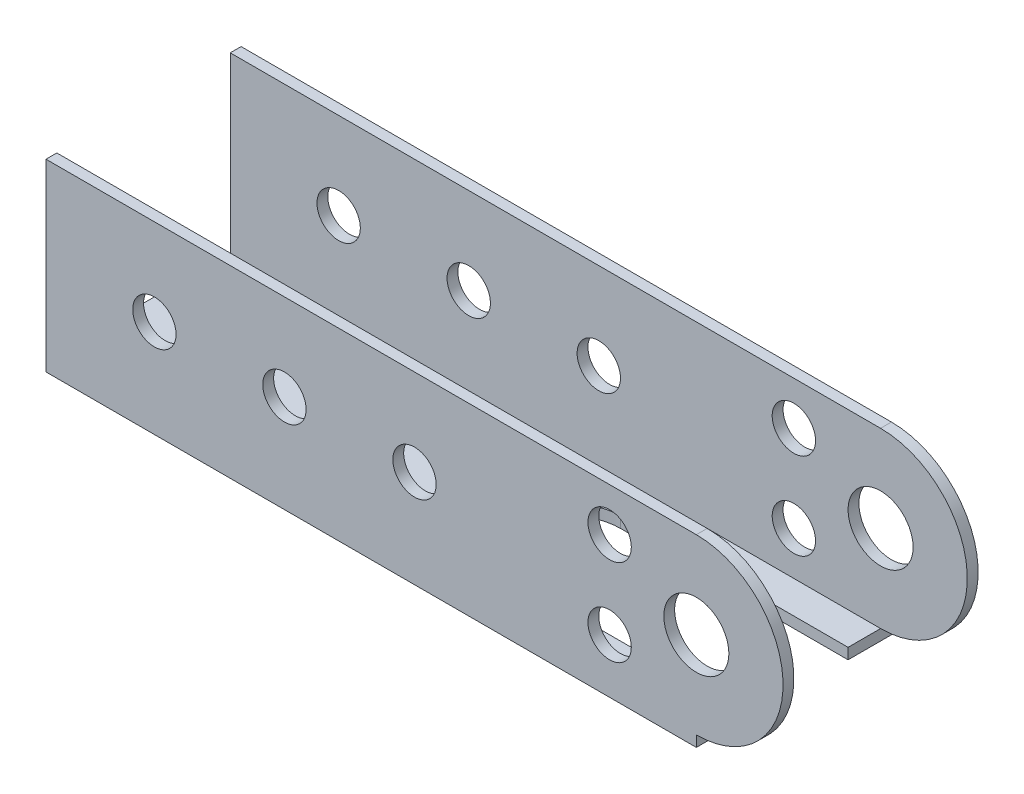
from build123d import *

# Parameters (mm, degrees)
SKETCH_2_R      = 1.5
SKETCH_2_R_2    = 1
EXTRUDE_1_DEPTH = 0.5
SKETCH_1_R      = 1.5
SKETCH_1_R_2    = 1
EXTRUDE_2_DEPTH = 0.5
EXTRUDE_4_DEPTH = 0.5
FILLET_1_R      = 2.5


with BuildPart() as part:
    # 草图2 → 凸台-拉伸1 (new body)
    with BuildSketch(Plane.XY.offset(8)):
        with BuildLine():
            Line((15, 4), (-15, 4))
            Line((-15, 4), (-15, -4))
            Line((-15, -4), (15, -4))
            ThreePointArc((15, -4), (19, 0), (15, 4))
        make_face()
        with Locations((15, 0)):
            Circle(SKETCH_2_R, mode=Mode.SUBTRACT)
        with Locations((11, -2)):
            Circle(SKETCH_2_R_2, mode=Mode.SUBTRACT)
        with Locations((11, 2)):
            Circle(SKETCH_2_R_2, mode=Mode.SUBTRACT)
        with Locations((2, 0)):
            Circle(SKETCH_2_R_2, mode=Mode.SUBTRACT)
        with Locations((-4, 0)):
            Circle(SKETCH_2_R_2, mode=Mode.SUBTRACT)
        with Locations((-10, 0)):
            Circle(SKETCH_2_R_2, mode=Mode.SUBTRACT)
    extrude(amount=EXTRUDE_1_DEPTH)



with BuildPart() as body_2:
    # 草图1 → 凸台-拉伸2 (new body)
    with BuildSketch(Plane.XY):
        with BuildLine():
            Line((-15, 4), (15, 4))
            ThreePointArc((15, 4), (19, 0), (15, -4))
            Line((15, -4), (-15, -4))
            Line((-15, -4), (-15, 4))
        make_face()
        with Locations((15, 0)):
            Circle(SKETCH_1_R, mode=Mode.SUBTRACT)
        with Locations((-10, 0)):
            Circle(SKETCH_1_R_2, mode=Mode.SUBTRACT)
        with Locations((-4, 0)):
            Circle(SKETCH_1_R_2, mode=Mode.SUBTRACT)
        with Locations((2, 0)):
            Circle(SKETCH_1_R_2, mode=Mode.SUBTRACT)
        with Locations((11, 2)):
            Circle(SKETCH_1_R_2, mode=Mode.SUBTRACT)
        with Locations((11, -2)):
            Circle(SKETCH_1_R_2, mode=Mode.SUBTRACT)
    extrude(amount=-EXTRUDE_2_DEPTH)


with BuildPart() as part_1:
    add(part.part)

    add(body_2.part)  # 凸台-拉伸4 merges body 2
    # 草图4 → 凸台-拉伸4 (add)
    with BuildSketch(Plane(origin=(0, -4, 0), x_dir=(1, 0, 0), z_dir=(0, 1, 0))):
        Polygon((-15, 0.5), (2, 0.5), (15, 0.5), (15, -1.5), (2, -1.5), (2, -6.5), (15, -6.5), (15, -8.5), (2, -8.5), (-15, -8.5), align=None)
    extrude(amount=-EXTRUDE_4_DEPTH)

    # 圆角1
    fillet_1_edges = [part_1.edges().sort_by_distance(p)[0] for p in [
        (2, -4.25, 1.5),
        (2, -4.25, 6.5),
    ]]
    fillet(fillet_1_edges, radius=FILLET_1_R - 0.0001)  # a hair under: the kernel refuses the full size


solid = part_1.part
